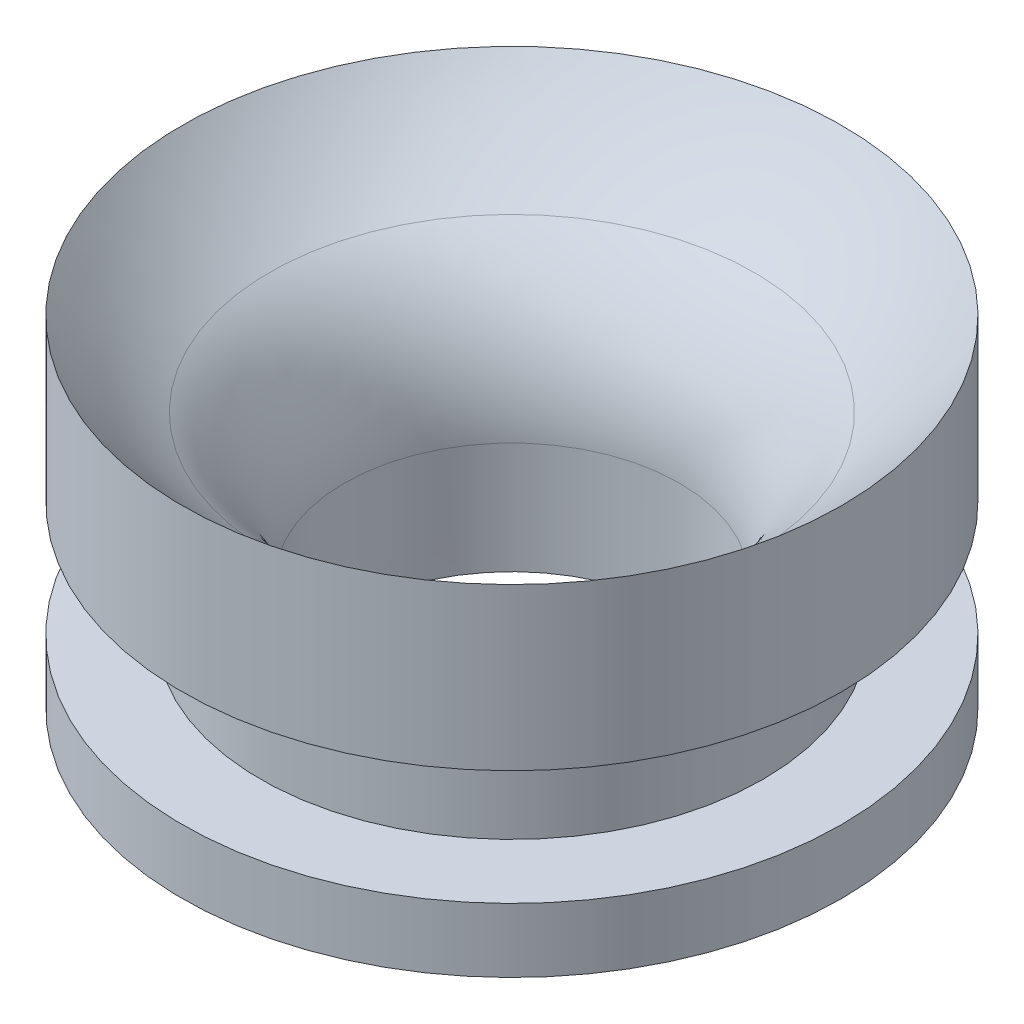
from build123d import *

# Parameters (mm, degrees)
SKETCH4_R          = 4.7752
CUT_EXTRUDE1_DEPTH = 12.446
FILLET2_R          = 5.08


with BuildPart() as part:
    # Sketch3 → Revolve3 (revolve)
    with BuildSketch(Plane.XY):
        with BuildLine():
            Line((0, 5.1054), (0, 0))
            Line((0, 0), (9.398, 0))
            Line((9.398, 0), (9.398, 1.8288))
            Line((9.398, 1.8288), (7.1628, 1.8288))
            Line((7.1628, 1.8288), (7.1628, 5.1054))
            Line((7.1628, 5.1054), (9.398, 5.1054))
            Line((9.398, 5.1054), (9.398, 9.7028))
            ThreePointArc((9.398, 9.7028), (5.231120596, 6.316339666), (0, 5.1054))
        make_face()
    revolve(axis=Axis((0, 0, 0), (0, 1, 0)))

    # Sketch4 → Cut-Extrude1 (cut)
    with BuildSketch(Plane.XZ):
        Circle(SKETCH4_R)
    extrude(amount=-CUT_EXTRUDE1_DEPTH, mode=Mode.SUBTRACT)

    # Fillet2
    fillet2_edges = [part.edges().sort_by_distance(p)[0] for p in [
        (-4.7752, 6.105113597, 0),
    ]]
    fillet(fillet2_edges, radius=FILLET2_R)


solid = part.part
